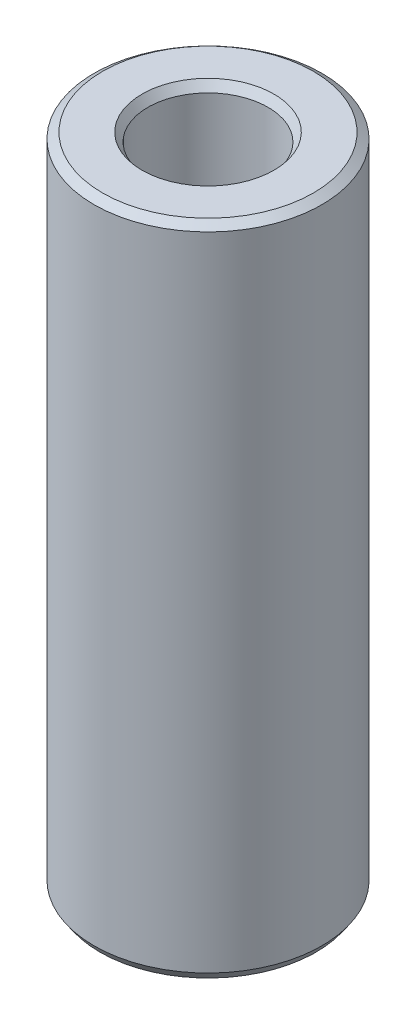
from build123d import *
from OCP.BRepFilletAPI import BRepFilletAPI_MakeChamfer

# Parameters (mm, degrees)
SKETCH1_R           = 40
BOSS_EXTRUDE1_DEPTH = 230.466114613
SKETCH2_R           = 21.104658584
CUT_EXTRUDE1_DEPTH  = 238.307037369
CHAMFER1_SIZE       = 2.070788233
CHAMFER1_SIZE2      = 2.980497518


with BuildPart() as part:
    # Sketch1 → Boss-Extrude1 (new body)
    with BuildSketch(Plane(origin=(0, 0, 0), x_dir=(1, 0, 0), z_dir=(0, 1, 0))):
        Circle(SKETCH1_R)
    extrude(amount=BOSS_EXTRUDE1_DEPTH)

    # Sketch2 → Cut-Extrude1 (cut, through all)
    with BuildSketch(Plane(origin=(0, 0, 0), x_dir=(1, 0, 0), z_dir=(0, 1, 0))):
        Circle(SKETCH2_R)
    extrude(amount=CUT_EXTRUDE1_DEPTH, mode=Mode.SUBTRACT)

    # Chamfer1: one chamfer whose edges measure the first distance from different faces: ONE call of the kernel's chamfer builder (chamfer() names one face for all edges)
    chamfer1_edges_1 = [part.edges().sort_by_distance(p)[0] for p in [
        (-21.104658584, 230.466114613, 0),
    ]]
    chamfer1_side_1 = [part.faces().sort_by_distance(p)[0] for p in [
        (-38.86862915, 230.466114613, 0),
    ]]
    chamfer1_edges_2 = [part.edges().sort_by_distance(p)[0] for p in [
        (-21.104658584, 0, 0),
    ]]
    chamfer1_side_2 = [part.faces().sort_by_distance(p)[0] for p in [
        (-21.104658584, 115.233057306, 0),
    ]]
    chamfer1_edges_3 = [part.edges().sort_by_distance(p)[0] for p in [
        (-40, 0, 0),
    ]]
    chamfer1_side_3 = [part.faces().sort_by_distance(p)[0] for p in [
        (-38.86862915, 0, 0),
    ]]
    chamfer1_edges_4 = [part.edges().sort_by_distance(p)[0] for p in [
        (-40, 230.466114613, 0),
    ]]
    chamfer1_side_4 = [part.faces().sort_by_distance(p)[0] for p in [
        (-40, 115.233057306, 0),
    ]]
    chamfer1 = BRepFilletAPI_MakeChamfer(part.part.solid().wrapped)
    for e in chamfer1_edges_1:
        chamfer1.Add(CHAMFER1_SIZE, CHAMFER1_SIZE2, e.wrapped, chamfer1_side_1[0].wrapped)  # the first distance lies on this face
    for e in chamfer1_edges_2:
        chamfer1.Add(CHAMFER1_SIZE, CHAMFER1_SIZE2, e.wrapped, chamfer1_side_2[0].wrapped)  # the first distance lies on this face
    for e in chamfer1_edges_3:
        chamfer1.Add(CHAMFER1_SIZE, CHAMFER1_SIZE2, e.wrapped, chamfer1_side_3[0].wrapped)  # the first distance lies on this face
    for e in chamfer1_edges_4:
        chamfer1.Add(CHAMFER1_SIZE, CHAMFER1_SIZE2, e.wrapped, chamfer1_side_4[0].wrapped)  # the first distance lies on this face
    add(Compound.cast(chamfer1.Shape()), mode=Mode.REPLACE)


solid = part.part
